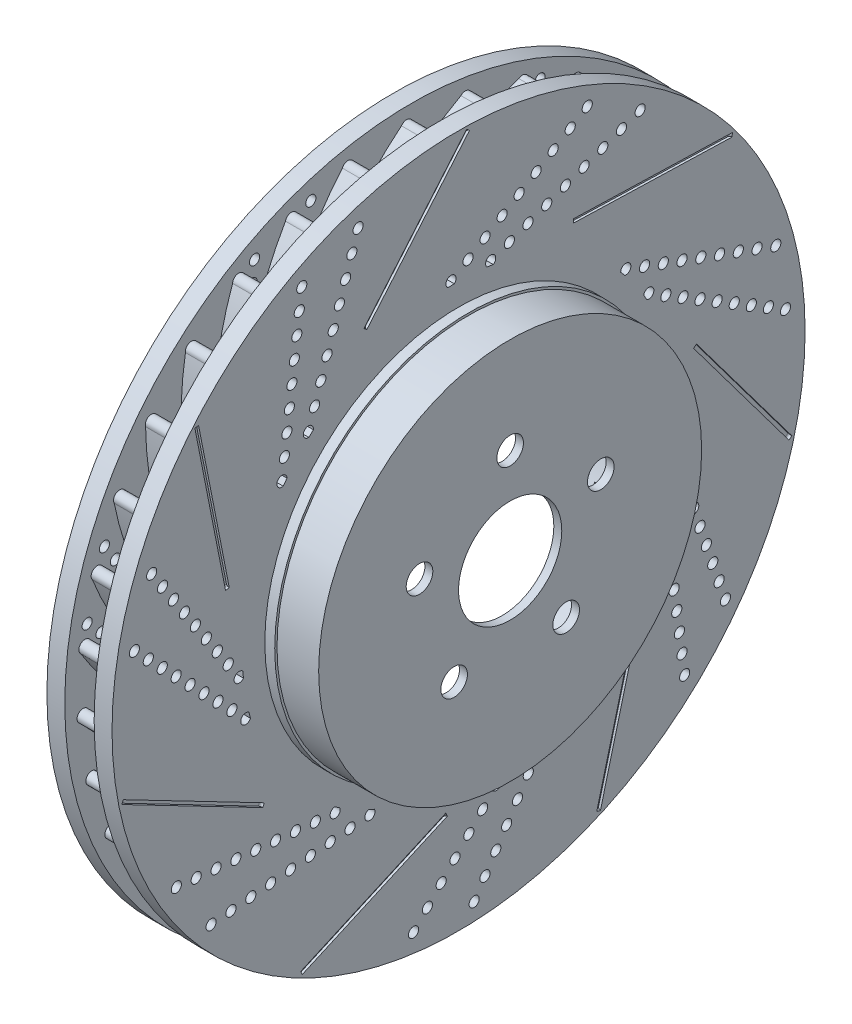
from build123d import *

# Parameters (mm, degrees)
SKETCH1_R                = 87.27
BOSS_EXTRUDE1_DEPTH      = 4.5
SKETCH2_R                = 49.72
CUT_EXTRUDE1_DEPTH       = 124.500428339
SKETCH4_R                = 1.28
CUT_EXTRUDE2_DEPTH       = 124.500428339
CIRPATTERN1_COUNT        = 7
CUT_EXTRUDE3_DEPTH       = 0.6
FILLET1_R                = 0.6
CIRPATTERN2_COUNT        = 7
FILLET1_OF_CIRPATTERN2_R = 0.6
BOSS_EXTRUDE2_START      = 7
BOSS_EXTRUDE2_DEPTH      = 7
SKETCH12_R               = 53.345
CUT_EXTRUDE5_DEPTH       = 4.5
SKETCH14_R               = 13
SKETCH14_R_2             = 3.35
CUT_EXTRUDE6_DEPTH       = 127.870047198


with BuildPart() as part:
    # Sketch1 → Boss-Extrude1 (new body)
    with BuildSketch(Plane(origin=(0, 0, 0), x_dir=(0, 0, -1), z_dir=(1, 0, 0))):
        Circle(SKETCH1_R)
    extrude(amount=BOSS_EXTRUDE1_DEPTH)

    # Sketch2 → Cut-Extrude1 (cut, through all)
    with BuildSketch(Plane(origin=(4.5, 0, 0), x_dir=(0, 0, -1), z_dir=(1, 0, 0))):
        Circle(SKETCH2_R)
    extrude(amount=-CUT_EXTRUDE1_DEPTH, mode=Mode.SUBTRACT)

    # Sketch4 → Cut-Extrude2 (cut, through all)
    with BuildSketch(Plane(origin=(4.5, 0, 0), x_dir=(0, 0, -1), z_dir=(1, 0, 0))):
        with Locations((-22.32, -50.721196999)):
            Circle(SKETCH4_R)
        with Locations((-31.072217933, -45.883978661)):
            Circle(SKETCH4_R)
        with Locations((-36.072217933, -45.421022845)):
            Circle(SKETCH4_R)
        with Locations((-46.072217933, -44.495111213)):
            Circle(SKETCH4_R)
        with Locations((-61.072217933, -43.106243766)):
            Circle(SKETCH4_R)
        with Locations((-41.072217933, -44.958067029)):
            Circle(SKETCH4_R)
        with Locations((-66.072217933, -42.643287951)):
            Circle(SKETCH4_R)
        with Locations((-51.072217933, -44.032155398)):
            Circle(SKETCH4_R)
        with Locations((-56.072217933, -43.569199582)):
            Circle(SKETCH4_R)
        with Locations((-71.072217933, -42.180332135)):
            Circle(SKETCH4_R)
        with Locations((-27.32, -51.22114472)):
            Circle(SKETCH4_R)
        with Locations((-32.32, -51.721092442)):
            Circle(SKETCH4_R)
        with Locations((-37.32, -52.221040163)):
            Circle(SKETCH4_R)
        with Locations((-42.32, -52.720987885)):
            Circle(SKETCH4_R)
        with Locations((-47.32, -53.220935606)):
            Circle(SKETCH4_R)
        with Locations((-52.32, -53.720883327)):
            Circle(SKETCH4_R)
        with Locations((-57.32, -54.220831049)):
            Circle(SKETCH4_R)
        with Locations((-62.32, -54.72077877)):
            Circle(SKETCH4_R)
    cut_extrude2 = extrude(amount=-CUT_EXTRUDE2_DEPTH, mode=Mode.SUBTRACT)

    # CirPattern1: Cut-Extrude2 ×7 about axis
    cirpattern1_axis = Axis((0, 0, 0), (1, 0, 0))
    for i in range(1, CIRPATTERN1_COUNT):
        add(cut_extrude2.rotate(cirpattern1_axis, i * 360 / CIRPATTERN1_COUNT), mode=Mode.SUBTRACT)

    # Sketch8 → Cut-Extrude3 (cut)
    with BuildSketch(Plane(origin=(4.5, 0, 0), x_dir=(0, 0, -1), z_dir=(1, 0, 0))):
        Polygon((-3.222332444, -59.968417679), (-39.76415075, -76.237883402), (-39.381818306, -77.096616132), (-2.84, -60.827150409), align=None)
    cut_extrude3 = extrude(amount=-CUT_EXTRUDE3_DEPTH, mode=Mode.SUBTRACT)

    # Fillet1
    fillet1_edges = [part.edges().sort_by_distance(p)[0] for p in [
        (3.9, -76.667249767, 39.572984528),
        (3.9, -60.397784044, 3.031166222),
    ]]
    fillet(fillet1_edges, radius=FILLET1_R - 0.0001)  # a hair under: the kernel refuses the full size

    # CirPattern2: Cut-Extrude3 ×7 about axis
    cirpattern2_axis = Axis((0, 0, 0), (1, 0, 0))
    for i in range(1, CIRPATTERN2_COUNT):
        add(cut_extrude3.rotate(cirpattern2_axis, i * 360 / CIRPATTERN2_COUNT), mode=Mode.SUBTRACT)

    # Fillet1 of CirPattern2
    fillet1_of_cirpattern2_edges = [part.edges().sort_by_distance(p)[0] for p in [
        (3.9, -78.740653525, -35.26751726),
        (3.9, -40.027263587, -45.330987809),
        (3.9, -21.520739163, -83.550859224),
        (3.9, 10.484602758, -59.557983437),
        (3.9, 51.904730732, -68.918700066),
        (3.9, 53.101349379, -28.936602775),
        (3.9, 86.244879723, -2.389354073),
        (3.9, 55.731696848, 23.474629976),
        (3.9, 55.640875207, 65.939224271),
        (3.9, 16.394939871, 58.208987559),
        (3.9, -16.861843207, 84.614221824),
        (3.9, -35.287541225, 49.110790264),
    ]]
    fillet(fillet1_of_cirpattern2_edges, radius=FILLET1_OF_CIRPATTERN2_R - 0.0001)  # a hair under: the kernel refuses the full size


with BuildPart() as body_2:
    # Mirror1: mirrored copy
    add(part.part.mirror(Plane.ZY.offset(3.7)))

    # Sketch9 → Boss-Extrude2 (add)
    with BuildSketch(Plane(origin=(-7.4, 0, 0), x_dir=(0, 0, -1), z_dir=(1, 0, 0)).offset(BOSS_EXTRUDE2_START)):
        with BuildLine():
            ThreePointArc((-75.385312818, -32.114500689), (-77.156943282, -33.365237872), (-75.906206099, -35.136868336))
            add(Edge.make_bspline(
                [(-28.230864418, -40.92794515), (-52.49959434, -47.346737156), (-75.906206099, -35.136868336)],
                knots=[0, 0, 0, 1, 1, 1], degree=2))
            ThreePointArc((-28.230864418, -40.92794515), (-29.147456129, -40.280320272), (-30.049196806, -39.612172009))
            add(Edge.make_bspline(
                [(-30.049196806, -39.612172009), (-53.196236096, -45.799056888), (-75.385312818, -32.114500689)],
                knots=[0, 0, 0, 1, 1, 1], degree=2))
        make_face()
        with BuildLine():
            ThreePointArc((-68.439574306, -45.058974822), (-69.959406192, -46.605948977), (-68.412432036, -48.125780863))
            add(Edge.make_bspline(
                [(-20.469216016, -45.311031722), (-43.201817895, -55.960020155), (-68.412432036, -48.125780863)],
                knots=[0, 0, 0, 1, 1, 1], degree=2))
            ThreePointArc((-20.469216016, -45.311031722), (-21.486715609, -44.837478211), (-22.493267421, -44.341079382))
            add(Edge.make_bspline(
                [(-22.493267421, -44.341079382), (-44.163613314, -54.561601934), (-68.439574306, -45.058974822)],
                knots=[0, 0, 0, 1, 1, 1], degree=2))
        make_face()
        with BuildLine():
            ThreePointArc((-79.908105348, -18.137840081), (-81.874592729, -19.052140568), (-80.960292242, -21.018627949))
            add(Edge.make_bspline(
                [(-35.085149609, -35.229400746), (-60.109990626, -37.211691068), (-80.960292242, -21.018627949)],
                knots=[0, 0, 0, 1, 1, 1], degree=2))
            ThreePointArc((-35.085149609, -35.229400746), (-35.871373427, -34.428519696), (-36.639320281, -33.610096836))
            add(Edge.make_bspline(
                [(-36.639320281, -33.610096836), (-60.519088079, -35.56449247), (-79.908105348, -18.137840081)],
                knots=[0, 0, 0, 1, 1, 1], degree=2))
        make_face()
        with BuildLine():
            ThreePointArc((-81.862585624, -3.578214369), (-83.9607254, -4.126691791), (-83.412247978, -6.224831566))
            add(Edge.make_bspline(
                [(-40.811769223, -28.398554415), (-65.788402355, -25.880630611), (-83.412247978, -6.224831566)],
                knots=[0, 0, 0, 1, 1, 1], degree=2))
            ThreePointArc((-40.811769223, -28.398554415), (-41.442355268, -27.470158169), (-42.051825856, -26.527765496))
            add(Edge.make_bspline(
                [(-42.051825856, -26.527765496), (-65.896806777, -24.186856001), (-81.862585624, -3.578214369)],
                knots=[0, 0, 0, 1, 1, 1], degree=2))
        make_face()
        with BuildLine():
            ThreePointArc((-81.185935041, 11.096418097), (-83.348291273, 10.931392257), (-83.183265432, 8.769036025))
            add(Edge.make_bspline(
                [(-45.226664995, -20.654955178), (-69.352320701, -13.717745392), (-83.183265432, 8.769036025)],
                knots=[0, 0, 0, 1, 1, 1], degree=2))
            ThreePointArc((-45.226664995, -20.654955178), (-45.681345712, -19.628883156), (-46.112751147, -18.592809945))
            add(Edge.make_bspline(
                [(-46.112751147, -18.592809945), (-69.156547884, -12.03183408), (-81.185935041, 11.096418097)],
                knots=[0, 0, 0, 1, 1, 1], degree=2))
        make_face()
        with BuildLine():
            ThreePointArc((-77.899901707, 25.414402556), (-80.056974485, 25.638132362), (-80.280704292, 23.481059583))
            add(Edge.make_bspline(
                [(-48.187938541, -12.247488688), (-70.687198396, -1.113960548), (-80.280704292, 23.481059583)],
                knots=[0, 0, 0, 1, 1, 1], degree=2))
            ThreePointArc((-48.187938541, -12.247488688), (-48.452100118, -11.156719688), (-48.691574675, -10.060266185))
            add(Edge.make_bspline(
                [(-48.691574675, -10.060266185), (-70.19354064, 0.509900889), (-77.899901707, 25.414402556)],
                knots=[0, 0, 0, 1, 1, 1], degree=2))
        make_face()
        with BuildLine():
            ThreePointArc((-72.110101434, 38.915547205), (-74.192560667, 39.520841799), (-74.797855261, 37.438382566))
            add(Edge.make_bspline(
                [(-49.600412093, -3.446377833), (-69.750131373, 11.525627904), (-74.797855261, 37.438382566)],
                knots=[0, 0, 0, 1, 1, 1], degree=2))
            ThreePointArc((-49.600412093, -3.446377833), (-49.665564159, -2.325970069), (-49.705410929, -1.204377192))
            add(Edge.make_bspline(
                [(-49.705410929, -1.204377192), (-68.974455245, 13.035247224), (-72.110101434, 38.915547205)],
                knots=[0, 0, 0, 1, 1, 1], degree=2))
        make_face()
        with BuildLine():
            ThreePointArc((-64.00262317, 51.165914147), (-65.943536903, 52.133318862), (-66.910941618, 50.192405129))
            add(Edge.make_bspline(
                [(-49.41868759, 5.465502441), (-66.571237738, 23.794773191), (-66.910941618, 50.192405129)],
                knots=[0, 0, 0, 1, 1, 1], degree=2))
            ThreePointArc((-49.41868759, 5.465502441), (-49.282736104, 6.579538141), (-49.121674378, 7.690221476))
            add(Edge.make_bspline(
                [(-49.121674378, 7.690221476), (-65.538474106, 25.141629987), (-64.00262317, 51.165914147)],
                knots=[0, 0, 0, 1, 1, 1], degree=2))
        make_face()
        with BuildLine():
            ThreePointArc((-53.838047935, 61.771766509), (-55.575033604, 63.070188162), (-56.873455256, 61.333202493))
            add(Edge.make_bspline(
                [(-47.648605805, 14.201716969), (-61.252689746, 35.29913489), (-56.873455256, 61.333202493)],
                knots=[0, 0, 0, 1, 1, 1], degree=2))
            ThreePointArc((-47.648605805, 14.201716969), (-47.31592036, 15.273574582), (-46.959126795, 16.337650097))
            add(Edge.make_bspline(
                [(-46.959126795, 16.337650097), (-59.996032484, 36.439940076), (-53.838047935, 61.771766509)],
                knots=[0, 0, 0, 1, 1, 1], degree=2))
        make_face()
        with BuildLine():
            ThreePointArc((-41.943073542, 70.39222347), (-43.420302998, 71.979929719), (-45.008009247, 70.502700263))
            add(Edge.make_bspline(
                [(-44.347058624, 22.481476629), (-53.965429908, 45.66895335), (-45.008009247, 70.502700263)],
                knots=[0, 0, 0, 1, 1, 1], degree=2))
            ThreePointArc((-44.347058624, 22.481476629), (-43.828332004, 23.476705769), (-43.287274238, 24.459973201))
            add(Edge.make_bspline(
                [(-43.287274238, 24.459973201), (-52.525269013, 46.567040508), (-41.943073542, 70.39222347)],
                knots=[0, 0, 0, 1, 1, 1], degree=2))
        make_face()
        with BuildLine():
            ThreePointArc((-28.700014254, 76.750216449), (-29.870008127, 78.576177111), (-31.695968788, 77.406183237))
            add(Edge.make_bspline(
                [(-39.62016049, 30.038663132), (-44.943676749, 54.570934072), (-31.695968788, 77.406183237)],
                knots=[0, 0, 0, 1, 1, 1], degree=2))
            ThreePointArc((-39.62016049, 30.038663132), (-38.932064995, 30.925276316), (-38.224133071, 31.796132641))
            add(Edge.make_bspline(
                [(-38.224133071, 31.796132641), (-43.366300178, 55.197437943), (-28.700014254, 76.750216449)],
                knots=[0, 0, 0, 1, 1, 1], degree=2))
        make_face()
        with BuildLine():
            ThreePointArc((-14.534512893, 80.641394321), (-15.359666618, 82.646921517), (-17.365193813, 81.821767792))
            add(Edge.make_bspline(
                [(-33.619837799, 36.630382286), (-34.477396839, 61.718960072), (-17.365193813, 81.821767792)],
                knots=[0, 0, 0, 1, 1, 1], degree=2))
            ThreePointArc((-33.619837799, 36.630382286), (-32.784489384, 37.379883036), (-31.932436816, 38.110338216))
            add(Edge.make_bspline(
                [(-31.932436816, 38.110338216), (-32.813502773, 62.053744306), (-14.534512893, 80.641394321)],
                knots=[0, 0, 0, 1, 1, 1], degree=2))
        make_face()
        with BuildLine():
            ThreePointArc((0.098139671, 81.940691428), (-0.355652785, 84.061325863), (-2.47628722, 83.607533407))
            add(Edge.make_bspline(
                [(-26.538945858, 42.044770814), (-22.902985027, 66.883287913), (-2.47628722, 83.607533407)],
                knots=[0, 0, 0, 1, 1, 1], degree=2))
            ThreePointArc((-26.538945858, 42.044770814), (-25.583193309, 42.63306956), (-24.614405768, 43.199646164))
            add(Edge.make_bspline(
                [(-24.614405768, 43.199646164), (-21.20605239, 66.915592268), (0.098139671, 81.940691428)],
                knots=[0, 0, 0, 1, 1, 1], degree=2))
        make_face()
        with BuildLine():
            ThreePointArc((14.727637945, 80.606347292), (14.65979202, 82.773930031), (12.492209281, 82.706084106))
            add(Edge.make_bspline(
                [(-18.605070361, 46.107805813), (-10.592452432, 69.897931848), (12.492209281, 82.706084106)],
                knots=[0, 0, 0, 1, 1, 1], degree=2))
            ThreePointArc((-18.605070361, 46.107805813), (-17.559632352, 46.515994149), (-16.505247465, 46.900481939))
            add(Edge.make_bspline(
                [(-16.505247465, 46.900481939), (-8.917022035, 69.626718037), (14.727637945, 80.606347292)],
                knots=[0, 0, 0, 1, 1, 1], degree=2))
        make_face()
        with BuildLine():
            ThreePointArc((28.883777818, 76.68124883), (29.204059048, 78.82611198), (27.059195897, 79.14639321))
            add(Edge.make_bspline(
                [(-10.073212594, 48.688897996), (2.0585303, 70.665998742), (27.059195897, 79.14639321)],
                knots=[0, 0, 0, 1, 1, 1], degree=2))
            ThreePointArc((-10.073212594, 48.688897996), (-8.971690362, 48.903856413), (-7.865596929, 49.093897635))
            add(Edge.make_bspline(
                [(-7.865596929, 49.093897635), (3.658608745, 70.099983799), (28.883777818, 76.68124883)],
                knots=[0, 0, 0, 1, 1, 1], degree=2))
        make_face()
        with BuildLine():
            ThreePointArc((42.111569306, 70.291551937), (42.809683589, 72.344757833), (40.756477693, 73.042872115))
            add(Edge.make_bspline(
                [(-1.217593486, 49.705088936), (14.643350174, 69.162802292), (40.756477693, 73.042872115)],
                knots=[0, 0, 0, 1, 1, 1], degree=2))
            ThreePointArc((-1.217593486, 49.705088936), (-0.095390862, 49.719908493), (1.026860365, 49.709395066))
            add(Edge.make_bspline(
                [(1.026860365, 49.709395066), (16.11664883, 68.320178403), (42.111569306, 70.291551937)],
                knots=[0, 0, 0, 1, 1, 1], degree=2))
        make_face()
        with BuildLine():
            ThreePointArc((53.985860307, 61.642626729), (55.039369675, 63.538183643), (53.143812762, 64.591693011))
            add(Edge.make_bspline(
                [(7.677160078, 49.12371742), (26.757520726, 65.436656469), (53.143812762, 64.591693011)],
                knots=[0, 0, 0, 1, 1, 1], degree=2))
            ThreePointArc((7.677160078, 49.12371742), (8.783974579, 48.937921805), (9.886313522, 48.727191638))
            add(Edge.make_bspline(
                [(9.886313522, 48.727191638), (28.056686561, 64.34450626), (53.985860307, 61.642626729)],
                knots=[0, 0, 0, 1, 1, 1], degree=2))
        make_face()
        with BuildLine():
            ThreePointArc((64.125001338, 51.012456778), (65.500045133, 52.689439951), (63.823061961, 54.064483746))
            add(Edge.make_bspline(
                [(16.325163401, 46.963469207), (38.011682544, 59.607322665), (63.823061961, 54.064483746)],
                knots=[0, 0, 0, 1, 1, 1], degree=2))
            ThreePointArc((16.325163401, 46.963469207), (17.381015849, 46.583030044), (18.428012427, 46.178856179))
            add(Edge.make_bspline(
                [(18.428012427, 46.178856179), (39.0949593, 58.300748742), (64.125001338, 51.012456778)],
                knots=[0, 0, 0, 1, 1, 1], degree=2))
        make_face()
        with BuildLine():
            ThreePointArc((72.203112064, 38.742704494), (73.855495247, 40.147214306), (72.450985435, 41.79959749))
            add(Edge.make_bspline(
                [(24.448462539, 43.293776452), (48.04411761, 51.862160466), (72.450985435, 41.79959749)],
                knots=[0, 0, 0, 1, 1, 1], degree=2))
            ThreePointArc((24.448462539, 43.293776452), (25.419416969, 42.730921368), (26.377419851, 42.146294286))
            add(Edge.make_bspline(
                [(26.377419851, 42.146294286), (48.876687881, 50.38315719), (72.203112064, 38.742704494)],
                knots=[0, 0, 0, 1, 1, 1], degree=2))
        make_face()
        with BuildLine():
            ThreePointArc((77.960555359, 25.227729809), (79.837168976, 26.314624161), (78.750274624, 28.191237778))
            add(Edge.make_bspline(
                [(31.785967976, 38.232586099), (56.532375205, 42.450105758), (78.750274624, 28.191237778)],
                knots=[0, 0, 0, 1, 1, 1], degree=2))
            ThreePointArc((31.785967976, 38.232586099), (32.640817112, 37.505405721), (33.479035297, 36.759115816))
            add(Edge.make_bspline(
                [(33.479035297, 36.759115816), (57.087479496, 40.84620951), (77.960555359, 25.227729809)],
                knots=[0, 0, 0, 1, 1, 1], degree=2))
        make_face()
        with BuildLine():
            ThreePointArc((81.212282259, 10.90191513), (83.252810403, 11.636260343), (82.518465191, 13.676788487))
            add(Edge.make_bspline(
                [(38.101846247, 31.942568972), (63.203635746, 31.673669722), (82.518465191, 13.676788487)],
                knots=[0, 0, 0, 1, 1, 1], degree=2))
            ThreePointArc((38.101846247, 31.942568972), (38.813114536, 31.074435474), (39.504607002, 30.190469119))
            add(Edge.make_bspline(
                [(39.504607002, 30.190469119), (63.463432549, 29.996431048), (81.212282259, 10.90191513)],
                knots=[0, 0, 0, 1, 1, 1], degree=2))
        make_face()
        with BuildLine():
            ThreePointArc((81.853779585, -3.77429607), (83.992638004, -3.416102457), (83.63444439, -1.277244038))
            add(Edge.make_bspline(
                [(43.193099831, 24.625891395), (67.84347943, 19.87921588), (83.63444439, -1.277244038)],
                knots=[0, 0, 0, 1, 1, 1], degree=2))
            ThreePointArc((43.193099831, 24.625891395), (43.737926523, 23.644707303), (44.260468134, 22.651475903))
            add(Edge.make_bspline(
                [(44.260468134, 22.651475903), (67.799618662, 18.182542611), (81.853779585, -3.77429607)],
                knots=[0, 0, 0, 1, 1, 1], degree=2))
        make_face()
        with BuildLine():
            ThreePointArc((79.864429086, -18.32919829), (82.032873109, -18.358668913), (82.062343732, -16.19022489))
            add(Edge.make_bspline(
                [(46.896091646, 16.517717407), (70.302777863, 7.445827683), (82.062343732, -16.19022489)],
                knots=[0, 0, 0, 1, 1, 1], degree=2))
            ThreePointArc((46.896091646, 16.517717407), (47.256965565, 15.455018784), (47.593761402, 14.384445614))
            add(Edge.make_bspline(
                [(47.593761402, 14.384445614), (69.956669246, 5.784252294), (79.864429086, -18.32919829)],
                knots=[0, 0, 0, 1, 1, 1], degree=2))
        make_face()
        with BuildLine():
            ThreePointArc((75.308170123, -32.294984995), (77.436504176, -32.711172645), (77.852691826, -30.582838592))
            add(Edge.make_bspline(
                [(49.091804489, 7.87865039), (70.502487171, -5.226875542), (77.852691826, -30.582838592)],
                knots=[0, 0, 0, 1, 1, 1], degree=2))
            ThreePointArc((49.091804489, 7.87865039), (49.25712685, 6.768593245), (49.397352018, 5.655087407))
            add(Edge.make_bspline(
                [(49.397352018, 5.655087407), (69.865254919, -6.799948651), (75.308170123, -32.294984995)],
                knots=[0, 0, 0, 1, 1, 1], degree=2))
        make_face()
        with BuildLine():
            ThreePointArc((68.331444609, -45.22278431), (70.351262284, -46.012312373), (71.140790346, -43.992494698))
            add(Edge.make_bspline(
                [(49.709666344, -1.013642932), (68.436188531, -17.731582686), (71.140790346, -43.992494698)],
                knots=[0, 0, 0, 1, 1, 1], degree=2))
            ThreePointArc((49.709666344, -1.013642932), (49.674123549, -2.13538045), (49.613271096, -3.256029961))
            add(Edge.make_bspline(
                [(49.613271096, -3.256029961), (67.528313814, -19.165593651), (68.331444609, -45.22278431)],
                knots=[0, 0, 0, 1, 1, 1], degree=2))
        make_face()
        with BuildLine():
            ThreePointArc((59.158490242, -56.697086128), (61.004872936, -57.834578522), (62.14236533, -55.988195827))
            add(Edge.make_bspline(
                [(48.729818621, -9.873356937), (64.170294482, -29.666382174), (62.14236533, -55.988195827)],
                knots=[0, 0, 0, 1, 1, 1], degree=2))
            ThreePointArc((48.729818621, -9.873356937), (48.494553045, -10.97072126), (48.23457882, -12.062495848))
            add(Edge.make_bspline(
                [(48.23457882, -12.062495848), (63.020957141, -30.915240702), (59.158490242, -56.697086128)],
                knots=[0, 0, 0, 1, 1, 1], degree=2))
        make_face()
        with BuildLine():
            ThreePointArc((48.084133323, -66.349096948), (49.697736778, -67.797993731), (51.146633561, -66.184390276))
            add(Edge.make_bspline(
                [(46.183754432, -18.415733126), (57.841914369, -40.647679729), (51.146633561, -66.184390276)],
                knots=[0, 0, 0, 1, 1, 1], degree=2))
            ThreePointArc((46.183754432, -18.415733126), (45.756327705, -19.453454063), (45.305587492, -20.481263193))
            add(Edge.make_bspline(
                [(45.305587492, -20.481263193), (56.488055051, -41.671246479), (48.084133323, -66.349096948)],
                knots=[0, 0, 0, 1, 1, 1], degree=2))
        make_face()
        with BuildLine():
            ThreePointArc((35.464312795, -73.868593199), (36.793274468, -75.582325637), (38.507006907, -74.253363964))
            add(Edge.make_bspline(
                [(42.153306376, -26.3662125), (49.654447536, -50.322527412), (38.507006907, -74.253363964)],
                knots=[0, 0, 0, 1, 1, 1], degree=2))
            ThreePointArc((42.153306376, -26.3662125), (41.547456344, -27.310936845), (40.920437305, -28.241745887))
            add(Edge.make_bspline(
                [(40.920437305, -28.241745887), (48.139580393, -51.087904108), (35.464312795, -73.868593199)],
                knots=[0, 0, 0, 1, 1, 1], degree=2))
        make_face()
        with BuildLine():
            ThreePointArc((21.704640073, -79.013892085), (22.706246043, -80.937379408), (24.629733366, -79.935773438))
            add(Edge.make_bspline(
                [(36.768016369, -33.46926011), (39.871045903, -58.379967658), (24.629733366, -79.935773438)],
                knots=[0, 0, 0, 1, 1, 1], degree=2))
            ThreePointArc((36.768016369, -33.46926011), (36.003215551, -34.290623646), (35.220070593, -35.094515631))
            add(Edge.make_bspline(
                [(35.220070593, -35.094515631), (38.243860012, -58.862554463), (21.704640073, -79.013892085)],
                knots=[0, 0, 0, 1, 1, 1], degree=2))
        make_face()
        with BuildLine():
            ThreePointArc((7.247362361, -81.619619467), (7.889420188, -83.691039209), (9.96083993, -83.048981383))
            add(Edge.make_bspline(
                [(30.200972063, -39.496578162), (28.806156049, -64.561027709), (9.96083993, -83.048981383)],
                knots=[0, 0, 0, 1, 1, 1], degree=2))
            ThreePointArc((30.200972063, -39.496578162), (29.301801786, -40.168181588), (28.387701834, -40.819318767))
            add(Edge.make_bspline(
                [(28.387701834, -40.819318767), (27.118950503, -64.745313886), (7.247362361, -81.619619467)],
                knots=[0, 0, 0, 1, 1, 1], degree=2))
        make_face()
        with BuildLine():
            ThreePointArc((-7.44285154, -81.602025123), (-7.180978124, -83.754800149), (-5.028203098, -83.492926733))
            add(Edge.make_bspline(
                [(22.663243665, -44.254443693), (16.815412637, -68.667043209), (-5.028203098, -83.492926733)],
                knots=[0, 0, 0, 1, 1, 1], degree=2))
            ThreePointArc((22.663243665, -44.254443693), (21.658604003, -44.754701124), (20.64292898, -45.232155411))
            add(Edge.make_bspline(
                [(20.64292898, -45.232155411), (15.122415612, -68.547105647), (-7.44285154, -81.602025123)],
                knots=[0, 0, 0, 1, 1, 1], degree=2))
        make_face()
        with BuildLine():
            ThreePointArc((-21.893846069, -78.961674548), (-22.02057389, -81.126612898), (-19.85563554, -81.25334072))
            add(Edge.make_bspline(
                [(14.397099969, -47.589934991), (4.284208028, -70.56604344), (-19.85563554, -81.25334072)],
                knots=[0, 0, 0, 1, 1, 1], degree=2))
            ThreePointArc((14.397099969, -47.589934991), (13.319280866, -47.902767741), (12.234675403, -48.191193363))
            add(Edge.make_bspline(
                [(12.234675403, -48.191193363), (2.63983384, -70.145737033), (-21.893846069, -78.961674548)],
                knots=[0, 0, 0, 1, 1, 1], degree=2))
        make_face()
        with BuildLine():
            ThreePointArc((-35.641154371, -73.783430784), (-36.152410293, -75.890949558), (-34.04489152, -76.40220548))
            add(Edge.make_bspline(
                [(5.668221634, -49.395846622), (-8.384694552, -70.196992973), (-34.04489152, -76.40220548)],
                knots=[0, 0, 0, 1, 1, 1], degree=2))
            ThreePointArc((5.668221634, -49.395846622), (4.551865082, -49.511199988), (3.433189293, -49.601326709))
            add(Edge.make_bspline(
                [(3.433189293, -49.601326709), (-9.927594364, -69.489826714), (-35.641154371, -73.783430784)],
                knots=[0, 0, 0, 1, 1, 1], degree=2))
        make_face()
        with BuildLine():
            ThreePointArc((-48.242926646, -66.233726845), (-49.122278483, -68.216088655), (-47.139916673, -69.095440493))
            add(Edge.make_bspline(
                [(-3.242838009, -49.614135099), (-20.784106151, -67.571753394), (-47.139916673, -69.095440493)],
                knots=[0, 0, 0, 1, 1, 1], degree=2))
            ThreePointArc((-3.242838009, -49.614135099), (-4.36185139, -49.52830153), (-5.478642347, -49.417232602))
            add(Edge.make_bspline(
                [(-5.478642347, -49.417232602), (-22.175941517, -66.600456188), (-48.242926646, -66.233726845)],
                knots=[0, 0, 0, 1, 1, 1], degree=2))
        make_face()
        with BuildLine():
            ThreePointArc((-59.294131564, -56.555216428), (-60.513316225, -58.348706535), (-58.719826118, -59.567891196))
            add(Edge.make_bspline(
                [(-12.049670169, -48.237784452), (-32.515499476, -62.774702062), (-58.719826118, -59.567891196)],
                knots=[0, 0, 0, 1, 1, 1], degree=2))
            ThreePointArc((-12.049670169, -48.237784452), (-13.135374369, -47.953522709), (-14.214385913, -47.644827979))
            add(Edge.make_bspline(
                [(-14.214385913, -47.644827979), (-33.711535662, -61.570492201), (-59.294131564, -56.555216428)],
                knots=[0, 0, 0, 1, 1, 1], degree=2))
        make_face()
    extrude(amount=-BOSS_EXTRUDE2_DEPTH)

    # Sketch12 → Cut-Extrude5 (cut)
    with BuildSketch(Plane.ZY.offset(11.9)):
        Circle(SKETCH12_R)
    extrude(amount=-CUT_EXTRUDE5_DEPTH, mode=Mode.SUBTRACT)


with BuildPart() as part_1:
    add(part.part)

    # Sketch13 → Revolve2 (revolve)
    with BuildSketch(Plane(origin=(0, 0, 0), x_dir=(1, 0, 0), z_dir=(0, 1, 0)), mode=Mode.PRIVATE) as revolve2_sk:
        Polygon((0, 54.416177939), (4.5, 54.416177939), (4.5, 48.7971133), (7.000387131, 48.7971133), (7.000387131, 48.224706552), (17.492227562, 48.224706552), (17.492227562, 0), (15.492227562, 0), (15.492227562, 43.858999492), (0, 44.4), align=None)
    revolve(revolve2_sk.sketch.rotate(Axis((0, 0, 0), (1, 0, 0)), 180), axis=Axis((0, 0, 0), (1, 0, 0)))

    # Sketch14 → Cut-Extrude6 (cut, through all)
    with BuildSketch(Plane(origin=(17.492227562, 0, 0), x_dir=(0, 0, -1), z_dir=(1, 0, 0))):
        Circle(SKETCH14_R)
        with Locations((0, 24)):
            Circle(SKETCH14_R_2)
        with Locations((22.825356391, 7.416407865)):
            Circle(SKETCH14_R_2)
        with Locations((14.106846055, -19.416407865)):
            Circle(SKETCH14_R_2)
        with Locations((-14.106846055, -19.416407865)):
            Circle(SKETCH14_R_2)
        with Locations((-22.825356391, 7.416407865)):
            Circle(SKETCH14_R_2)
    extrude(amount=-CUT_EXTRUDE6_DEPTH, mode=Mode.SUBTRACT)


solid = Compound([body_2.part, part_1.part])
